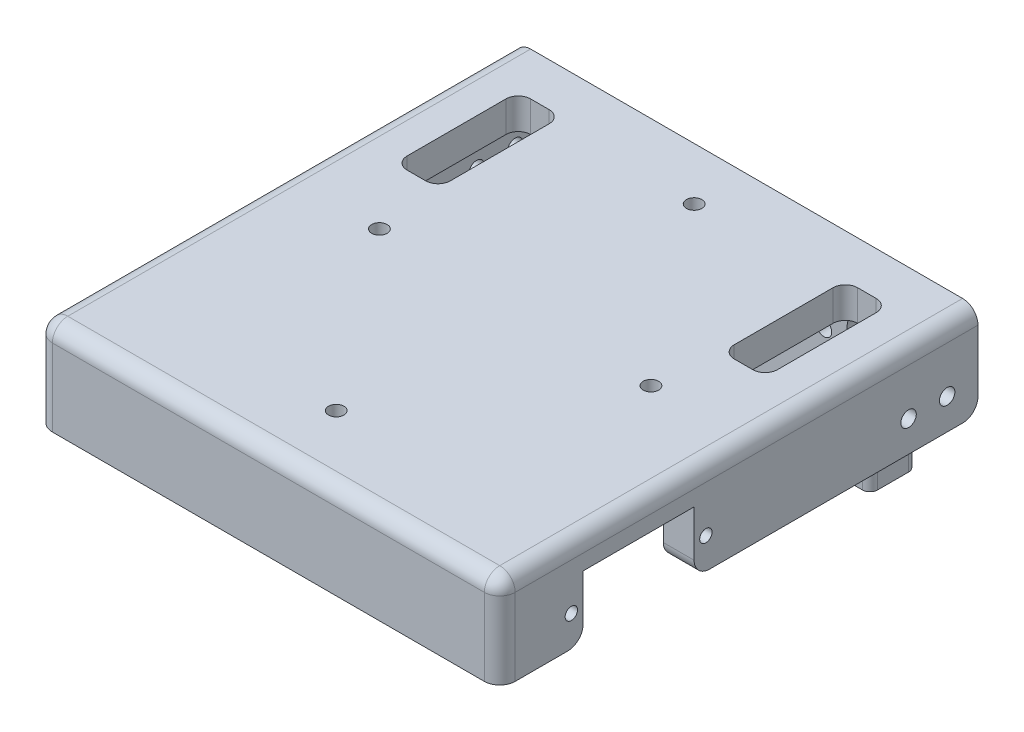
from build123d import *

# Parameters (mm, degrees)
SKETCH1_W               = 95.25
SKETCH1_H               = 95.25
BOSS_EXTRUDE1_DEPTH     = 6.35
SKETCH4_W               = 6.35
SKETCH4_H               = 95.25
BOSS_EXTRUDE2_DEPTH     = 12.7
CUT_EXTRUDE1_DEPTH      = 102.649597269
CUT_EXTRUDE1_DEPTH_BACK = 102.649597269
SKETCH5_W               = 22.86
SKETCH5_H               = 12.7
SKETCH6_R               = 1.27
CUT_EXTRUDE2_DEPTH      = 108.247345538
SKETCH7_R               = 1.5875
CUT_EXTRUDE3_DEPTH      = 69.538830235
CUT_EXTRUDE4_DEPTH      = 102.649597269
CUT_EXTRUDE4_DEPTH_BACK = 102.649597269
SKETCH8_R               = 1.5875
SKETCH9_W               = 95.25
SKETCH9_H               = 19.05
BOSS_EXTRUDE3_DEPTH     = 3.175
CUT_EXTRUDE5_DEPTH      = 71.781852371
SKETCH11_W              = 50.8
SKETCH11_H              = 38.1
BOSS_EXTRUDE4_DEPTH     = 4.7625
CUT_EXTRUDE6_REACH      = 115.858
SKETCH12_R              = 1.5875
SKETCH12_W              = 19.05
SKETCH12_H              = 15.875
FILLET1_R               = 6.985
FILLET2_R               = 6.35
FILLET3_R               = 3.175
FILLET4_R               = 3.175
FILLET5_R               = 3.175
SKETCH14_W              = 9.525
SKETCH14_H              = 9.525
BOSS_EXTRUDE5_DEPTH     = 9.525
SKETCH15_R              = 1.905
CUT_EXTRUDE7_DEPTH      = 76.268261904
FILLET7_R               = 1.5875
FILLET8_R               = 1.5875
CUT_EXTRUDE8_START      = -3.175
CUT_EXTRUDE8_DEPTH      = 3.175


with BuildPart() as part:
    # Sketch1 → Boss-Extrude1 (new body)
    with BuildSketch(Plane(origin=(0, 0, 0), x_dir=(1, 0, 0), z_dir=(0, 1, 0))):
        Rectangle(SKETCH1_W, SKETCH1_H)
    extrude(amount=BOSS_EXTRUDE1_DEPTH)

    # Sketch4 → Boss-Extrude2 (add)
    with BuildSketch(Plane(origin=(0, 0, 0), x_dir=(-1, 0, 0), z_dir=(0, -1, 0))):
        with Locations((-44.45, 0)):
            Rectangle(SKETCH4_W, SKETCH4_H)
        with Locations((44.45, 0)):
            Rectangle(SKETCH4_W, SKETCH4_H)
    extrude(amount=BOSS_EXTRUDE2_DEPTH)

    # Sketch5 → Cut-Extrude1 (cut, two sides: drawn at the far end of the back side and taken through both)
    with BuildSketch(Plane(origin=(-41.275, 0, 0), x_dir=(0, 0, -1), z_dir=(1, 0, 0)).offset(-CUT_EXTRUDE1_DEPTH_BACK)):
        with Locations((-22.225, -6.35)):
            Rectangle(SKETCH5_W, SKETCH5_H)
    extrude(amount=CUT_EXTRUDE1_DEPTH + CUT_EXTRUDE1_DEPTH_BACK, mode=Mode.SUBTRACT)

    # Sketch6 → Cut-Extrude2 (cut, through all)
    with BuildSketch(Plane.ZY.offset(47.625)):
        with Locations((36.068, -6.35)):
            Circle(SKETCH6_R)
        with Locations((8.382, -6.35)):
            Circle(SKETCH6_R)
    extrude(amount=-CUT_EXTRUDE2_DEPTH, mode=Mode.SUBTRACT)

    # Sketch7 → Cut-Extrude3 (cut, through all)
    with BuildSketch(Plane.XZ):
        with Locations(Location((27.94, 0, 0), (0, 0, 270))):
            Circle(SKETCH7_R)
        with Locations(Location((-27.94, 0, 0), (0, 0, 270))):
            Circle(SKETCH7_R)
        with Locations(Location((0, 36.83, 0), (0, 0, 270))):
            Circle(SKETCH7_R)
        with Locations(Location((0, -36.83, 0), (0, 0, 270))):
            Circle(SKETCH7_R)
    extrude(amount=-CUT_EXTRUDE3_DEPTH, mode=Mode.SUBTRACT)

    # Sketch8 → Cut-Extrude4 (cut, two sides: drawn at the far end of the back side and taken through both)
    with BuildSketch(Plane(origin=(-41.275, 0, 0), x_dir=(0, 0, -1), z_dir=(1, 0, 0)).offset(-CUT_EXTRUDE4_DEPTH_BACK)):
        with Locations((41.275, -6.35)):
            Circle(SKETCH8_R)
        with Locations((33.3375, -6.35)):
            Circle(SKETCH8_R)
    extrude(amount=CUT_EXTRUDE4_DEPTH + CUT_EXTRUDE4_DEPTH_BACK, mode=Mode.SUBTRACT)

    # Sketch9 → Boss-Extrude3 (add)
    with BuildSketch(Plane.XY.offset(47.625)):
        with Locations((0, -3.175)):
            Rectangle(SKETCH9_W, SKETCH9_H)
    extrude(amount=BOSS_EXTRUDE3_DEPTH)

    # Sketch10 → Cut-Extrude5 (cut, through all)
    with BuildSketch(Plane.XZ):
        with BuildLine():
            Line((-31.75, -38.735), (-35.56, -38.735))
            ThreePointArc((-35.56, -38.735), (-37.356051224, -37.991051224), (-38.1, -36.195))
            Line((-38.1, -36.195), (-38.1, -15.875))
            ThreePointArc((-38.1, -15.875), (-37.356051224, -14.078948776), (-35.56, -13.335))
            Line((-35.56, -13.335), (-31.75, -13.335))
            ThreePointArc((-31.75, -13.335), (-29.953948776, -14.078948776), (-29.21, -15.875))
            Line((-29.21, -15.875), (-29.21, -36.195))
            ThreePointArc((-29.21, -36.195), (-29.953948776, -37.991051224), (-31.75, -38.735))
        make_face()
        with BuildLine():
            Line((35.56, -38.735), (31.75, -38.735))
            ThreePointArc((31.75, -38.735), (29.953948776, -37.991051224), (29.21, -36.195))
            Line((29.21, -36.195), (29.21, -15.875))
            ThreePointArc((29.21, -15.875), (29.953948776, -14.078948776), (31.75, -13.335))
            Line((31.75, -13.335), (35.56, -13.335))
            ThreePointArc((35.56, -13.335), (37.356051224, -14.078948776), (38.1, -15.875))
            Line((38.1, -15.875), (38.1, -36.195))
            ThreePointArc((38.1, -36.195), (37.356051224, -37.991051224), (35.56, -38.735))
        make_face()
    extrude(amount=-CUT_EXTRUDE5_DEPTH, mode=Mode.SUBTRACT)

    # Sketch11 → Boss-Extrude4 (add)
    with BuildSketch(Plane(origin=(0, 0, -47.625), x_dir=(-1, 0, 0), z_dir=(0, 0, -1))):
        with Locations((0, -12.7)):
            Rectangle(SKETCH11_W, SKETCH11_H)
    extrude(amount=-BOSS_EXTRUDE4_DEPTH)

    # Sketch12 → Cut-Extrude6 (cut, up to next)
    with BuildSketch(Plane(origin=(0, 0, -47.625), x_dir=(-1, 0, 0), z_dir=(0, 0, -1)), mode=Mode.PRIVATE) as cut_extrude6_sk1:
        with Locations((-20.701, -8.382)):
            Circle(SKETCH12_R)
    cut_extrude6_tool1 = extrude(cut_extrude6_sk1.sketch, amount=-CUT_EXTRUDE6_REACH, mode=Mode.PRIVATE) & part.part
    # Sketch12 → Cut-Extrude6 (cut, up to next)
    with BuildSketch(Plane(origin=(0, 0, -47.625), x_dir=(-1, 0, 0), z_dir=(0, 0, -1)), mode=Mode.PRIVATE) as cut_extrude6_sk2:
        with Locations((-20.701, -25.4)):
            Circle(SKETCH12_R)
    cut_extrude6_tool2 = extrude(cut_extrude6_sk2.sketch, amount=-CUT_EXTRUDE6_REACH, mode=Mode.PRIVATE) & part.part
    # Sketch12 → Cut-Extrude6 (cut, up to next)
    with BuildSketch(Plane(origin=(0, 0, -47.625), x_dir=(-1, 0, 0), z_dir=(0, 0, -1)), mode=Mode.PRIVATE) as cut_extrude6_sk3:
        with Locations((20.701, -8.382)):
            Circle(SKETCH12_R)
    cut_extrude6_tool3 = extrude(cut_extrude6_sk3.sketch, amount=-CUT_EXTRUDE6_REACH, mode=Mode.PRIVATE) & part.part
    # Sketch12 → Cut-Extrude6 (cut, up to next)
    with BuildSketch(Plane(origin=(0, 0, -47.625), x_dir=(-1, 0, 0), z_dir=(0, 0, -1)), mode=Mode.PRIVATE) as cut_extrude6_sk4:
        with Locations((20.701, -25.4)):
            Circle(SKETCH12_R)
    cut_extrude6_tool4 = extrude(cut_extrude6_sk4.sketch, amount=-CUT_EXTRUDE6_REACH, mode=Mode.PRIVATE) & part.part
    # Sketch12 → Cut-Extrude6 (cut, up to next)
    with BuildSketch(Plane(origin=(0, 0, -47.625), x_dir=(-1, 0, 0), z_dir=(0, 0, -1)), mode=Mode.PRIVATE) as cut_extrude6_sk5:
        with Locations((0, -8.9535)):
            Rectangle(SKETCH12_W, SKETCH12_H)
    cut_extrude6_tool5 = extrude(cut_extrude6_sk5.sketch, amount=-CUT_EXTRUDE6_REACH, mode=Mode.PRIVATE) & part.part
    add(cut_extrude6_tool1.solids().sort_by_distance((20.701, -8.382, -47.625))[0], mode=Mode.SUBTRACT)
    add(cut_extrude6_tool2.solids().sort_by_distance((20.701, -25.4, -47.625))[0], mode=Mode.SUBTRACT)
    add(cut_extrude6_tool3.solids().sort_by_distance((-20.701, -8.382, -47.625))[0], mode=Mode.SUBTRACT)
    add(cut_extrude6_tool4.solids().sort_by_distance((-20.701, -25.4, -47.625))[0], mode=Mode.SUBTRACT)
    add(cut_extrude6_tool5.solids().sort_by_distance((0, -8.9535, -47.625))[0], mode=Mode.SUBTRACT)

    # Fillet1
    fillet1_edges = [part.edges().sort_by_distance(p)[0] for p in [
        (9.525, -1.016, -45.24375),
        (9.525, -16.891, -45.24375),
        (-9.525, -16.891, -45.24375),
        (-9.525, -1.016, -45.24375),
    ]]
    fillet(fillet1_edges, radius=FILLET1_R)

    # Fillet2
    fillet2_edges = [part.edges().sort_by_distance(p)[0] for p in [
        (-25.4, 0, -45.24375),
        (25.4, 0, -45.24375),
    ]]
    fillet(fillet2_edges, radius=FILLET2_R)

    # Fillet3
    fillet3_edges = [part.edges().sort_by_distance(p)[0] for p in [
        (44.45, -12.7, -47.625),
        (-44.45, -12.7, -47.625),
        (44.45, -12.7, 10.795),
        (-44.45, -12.7, 10.795),
        (44.45, -12.7, 33.655),
        (-44.45, -12.7, 33.655),
    ]]
    fillet(fillet3_edges, radius=FILLET3_R)

    # Fillet4
    fillet4_edges = [part.edges().sort_by_distance(p)[0] for p in [
        (41.275, 0, 40.64),
        (41.275, -6.35, 47.625),
        (0, 0, 47.625),
        (-41.275, 0, -18.415),
        (-41.275, -6.35, 47.625),
        (-41.275, 0, 40.64),
        (41.275, 0, -18.415),
    ]]
    fillet(fillet4_edges, radius=FILLET4_R - 0.0001)  # a hair under: the kernel refuses the full size

    # Fillet5
    fillet5_edges = [part.edges().sort_by_distance(p)[0] for p in [
        (-47.625, 6.35, 1.5875),
        (-47.625, -3.175, 50.8),
        (47.625, -3.175, 50.8),
        (0, 6.35, 50.8),
        (47.625, 6.35, 1.5875),
    ]]
    fillet(fillet5_edges, radius=FILLET5_R)

    # Sketch14 → Boss-Extrude5 (add)
    with BuildSketch(Plane.XZ.offset(31.75)):
        with Locations((-30.1625, -42.8625)):
            Rectangle(SKETCH14_W, SKETCH14_H)
        with Locations((30.1625, -42.8625)):
            Rectangle(SKETCH14_W, SKETCH14_H)
    extrude(amount=-BOSS_EXTRUDE5_DEPTH)

    # Sketch15 → Cut-Extrude7 (cut, through all)
    with BuildSketch(Plane(origin=(0, -22.225, 0), x_dir=(1, 0, 0), z_dir=(0, 1, 0))):
        with Locations(Location((-30.1625, 42.8625, 0), (0, 0, 270))):
            Circle(SKETCH15_R)
        with Locations(Location((30.1625, 42.8625, 0), (0, 0, 270))):
            Circle(SKETCH15_R)
    extrude(amount=-CUT_EXTRUDE7_DEPTH, mode=Mode.SUBTRACT)

    # Fillet7
    fillet7_edges = [part.edges().sort_by_distance(p)[0] for p in [
        (-25.4, -26.9875, -42.8625),
        (-25.4, -26.9875, -38.1),
        (-34.925, -26.9875, -47.625),
        (-34.925, -26.9875, -38.1),
        (25.4, -26.9875, -42.8625),
        (25.4, -26.9875, -38.1),
        (34.925, -26.9875, -38.1),
        (34.925, -26.9875, -47.625),
    ]]
    fillet(fillet7_edges, radius=FILLET7_R)

    # Fillet8
    fillet8_edges = [part.edges().sort_by_distance(p)[0] for p in [
        (-25.4, -22.225, -45.24375),
        (25.4, -22.225, -45.24375),
    ]]
    fillet(fillet8_edges, radius=FILLET8_R)

    # Sketch16 → Cut-Extrude8 (cut)
    with BuildSketch(Plane.XZ.offset(31.75).offset(CUT_EXTRUDE8_START)):
        with BuildLine():
            Line((-33.3375, -47.625), (33.3375, -47.625))
            ThreePointArc((33.3375, -47.625), (34.460032015, -47.160032015), (34.925, -46.0375))
            Line((34.925, -46.0375), (34.925, -39.6875))
            ThreePointArc((34.925, -39.6875), (34.460032015, -38.564967985), (33.3375, -38.1))
            Line((33.3375, -38.1), (26.9875, -38.1))
            ThreePointArc((26.9875, -38.1), (25.864967985, -38.564967985), (25.4, -39.6875))
            Line((25.4, -39.6875), (25.4, -41.275))
            ThreePointArc((25.4, -41.275), (24.935032015, -42.397532015), (23.8125, -42.8625))
            Line((23.8125, -42.8625), (-23.8125, -42.8625))
            ThreePointArc((-23.8125, -42.8625), (-24.935032015, -42.397532015), (-25.4, -41.275))
            Line((-25.4, -41.275), (-25.4, -39.6875))
            ThreePointArc((-25.4, -39.6875), (-25.864967985, -38.564967985), (-26.9875, -38.1))
            Line((-26.9875, -38.1), (-33.3375, -38.1))
            ThreePointArc((-33.3375, -38.1), (-34.460032015, -38.564967985), (-34.925, -39.6875))
            Line((-34.925, -39.6875), (-34.925, -46.0375))
            ThreePointArc((-34.925, -46.0375), (-34.460032015, -47.160032015), (-33.3375, -47.625))
        make_face()
    extrude(amount=CUT_EXTRUDE8_DEPTH, mode=Mode.SUBTRACT)


solid = part.part
